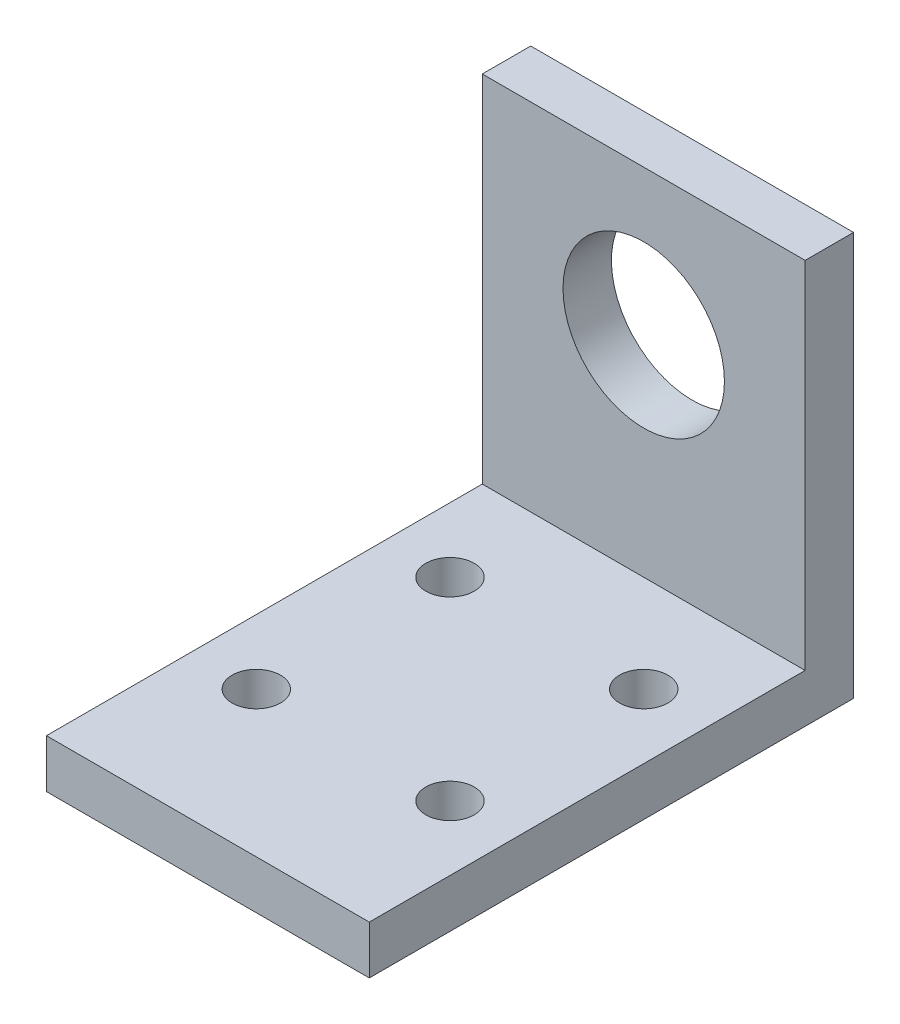
from build123d import *

# Parameters (mm, degrees)
EXTRUDE_1_DEPTH     = 20
CUT_EXTRUDE_1_REACH = 47.924
SKETCH_2_R          = 5
CUT_EXTRUDE_2_REACH = 47.924
SKETCH_3_R          = 1.5
SKETCH_4_W          = 20
SKETCH_4_H          = 8
CUT_EXTRUDE_3_DEPTH = 10
SKETCH_5_R          = 1.5
CUT_EXTRUDE_4_DEPTH = 10


with BuildPart() as part:
    # 草图1 → 凸台-拉伸1 (new body)
    with BuildSketch(Plane(origin=(0, 0, 0), x_dir=(0, 0, -1), z_dir=(1, 0, 0))):
        Polygon((0, 0), (0, 22), (3, 22), (3, -3), (-35, -3), (-35, 0), align=None)
    extrude(amount=EXTRUDE_1_DEPTH)

    # 草图2 → 切除-拉伸1 (cut, up to next)
    with BuildSketch(Plane.XY, mode=Mode.PRIVATE) as cut_extrude_1_sk1:
        with Locations((10, 13)):
            Circle(SKETCH_2_R)
    cut_extrude_1_tool1 = extrude(cut_extrude_1_sk1.sketch, amount=-CUT_EXTRUDE_1_REACH, mode=Mode.PRIVATE) & part.part
    add(cut_extrude_1_tool1.solids().sort_by_distance((10, 13, 0))[0], mode=Mode.SUBTRACT)

    # 草图3 → 切除-拉伸2 (cut, up to next)
    with BuildSketch(Plane(origin=(0, 0, 0), x_dir=(1, 0, 0), z_dir=(0, 1, 0)), mode=Mode.PRIVATE) as cut_extrude_2_sk1:
        with Locations((4, -6)):
            Circle(SKETCH_3_R)
    cut_extrude_2_tool1 = extrude(cut_extrude_2_sk1.sketch, amount=-CUT_EXTRUDE_2_REACH, mode=Mode.PRIVATE) & part.part
    # 草图3 → 切除-拉伸2 (cut, up to next)
    with BuildSketch(Plane(origin=(0, 0, 0), x_dir=(1, 0, 0), z_dir=(0, 1, 0)), mode=Mode.PRIVATE) as cut_extrude_2_sk2:
        with Locations((16, -6)):
            Circle(SKETCH_3_R)
    cut_extrude_2_tool2 = extrude(cut_extrude_2_sk2.sketch, amount=-CUT_EXTRUDE_2_REACH, mode=Mode.PRIVATE) & part.part
    add(cut_extrude_2_tool1.solids().sort_by_distance((4, 0, 6))[0], mode=Mode.SUBTRACT)
    add(cut_extrude_2_tool2.solids().sort_by_distance((16, 0, 6))[0], mode=Mode.SUBTRACT)

    # 草图4 → 切除-拉伸3 (cut)
    with BuildSketch(Plane.XZ.offset(3)):
        with Locations((10, 31)):
            Rectangle(SKETCH_4_W, SKETCH_4_H)
    extrude(amount=-CUT_EXTRUDE_3_DEPTH, mode=Mode.SUBTRACT)

    # 草图5 → 切除-拉伸4 (cut)
    with BuildSketch(Plane.XZ.offset(3)):
        with Locations((16, 18)):
            Circle(SKETCH_5_R)
        with Locations((4, 18)):
            Circle(SKETCH_5_R)
    extrude(amount=-CUT_EXTRUDE_4_DEPTH, mode=Mode.SUBTRACT)


solid = part.part
